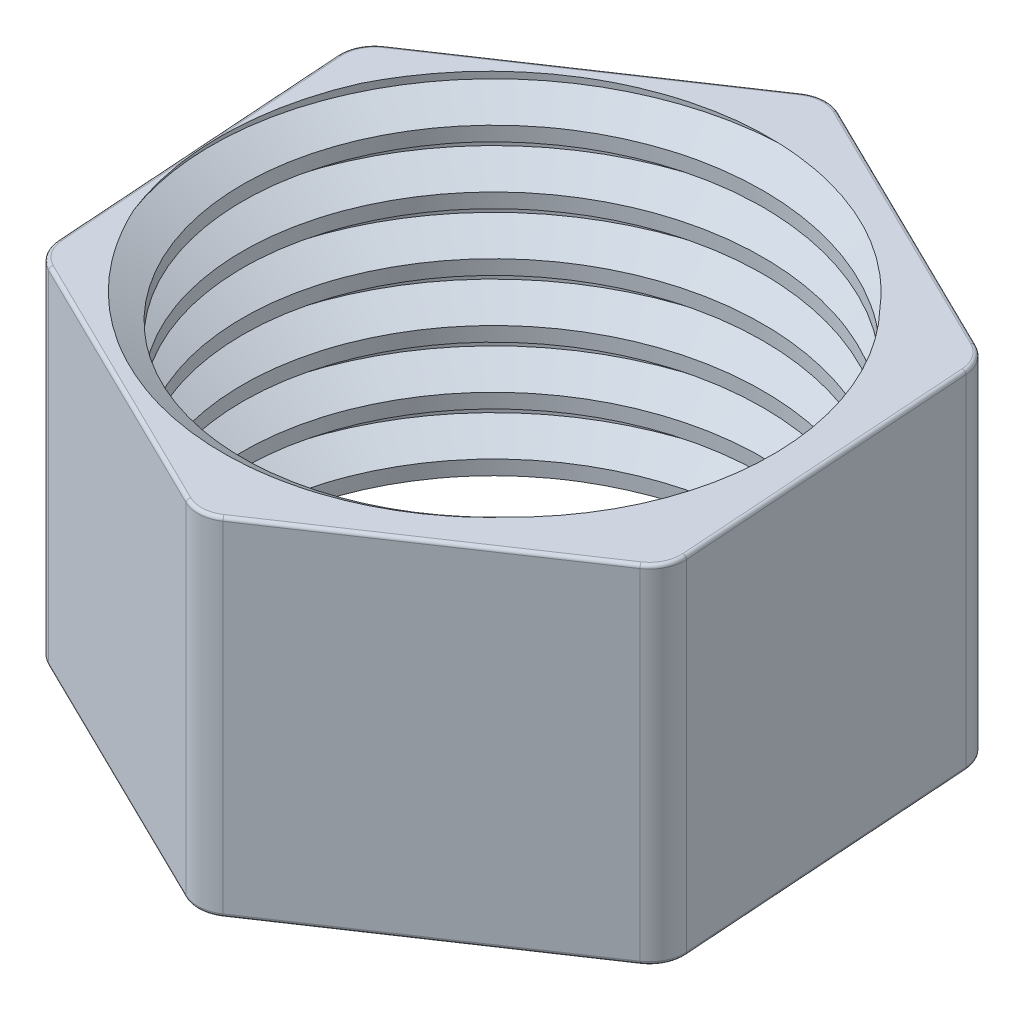
from build123d import *

# Parameters (mm, degrees)
SKETCH1_R           = 9.525
BOSS_EXTRUDE1_DEPTH = 6.35
THREAD1_PITCH       = 2.116666667
FILLET1_R           = 1.27
FILLET2_R           = 0.127


with BuildPart() as part:
    # Sketch1 → Boss-Extrude1 (new, symmetric)
    with BuildSketch(Plane(origin=(0, 0, 0), x_dir=(1, 0, 0), z_dir=(0, 1, 0))):
        Polygon((10.348040622, 6.949394838), (-0.844332159, 12.436363477), (-11.192372782, 5.486968639), (-10.348040622, -6.949394838), (0.844332159, -12.436363477), (11.192372782, -5.486968639), align=None)
        with Locations(Location((0, 0, 0), (0, 0, 270))):
            Circle(SKETCH1_R, mode=Mode.SUBTRACT)
    extrude(amount=BOSS_EXTRUDE1_DEPTH, both=True)

    # Thread1: the profile of Thread Profile1 profile screwed along a right-hand helix of 8.872441 turns, 10 arcs to a turn; built about Z, then put on its axis
    thread1_z = Axis((0, 0, 0), (0, 0, 1))
    thread1_corners = [(9.5247, 0, -0.000173205), (10.670679435, 0, 0.66145833), (10.670679435, 0, 0.926041664), (9.5247, 0, 1.587673199)]
    with BuildLine(mode=Mode.PRIVATE) as thread1_profile:
        Line(thread1_corners[0], thread1_corners[1])
        Line(thread1_corners[1], thread1_corners[2])
        Line(thread1_corners[2], thread1_corners[3])
        Line(thread1_corners[3], thread1_corners[0])
    thread1_cap = Face(thread1_profile.wire())
    thread1_turn_angles = [0, 18, 36, 54, 72, 90, 108, 126, 144, 162, 180, 198, 216, 234, 252, 270, 288, 306, 324, 342, 360]
    thread1_turn_weights = [1, 0.9510565162951535, 1, 0.9510565162951535, 1, 0.9510565162951535, 1, 0.9510565162951535, 1, 0.9510565162951535, 1, 0.9510565162951535, 1, 0.9510565162951535, 1, 0.9510565162951535, 1, 0.9510565162951535, 1, 0.9510565162951535, 1]
    thread1_turn_rails = [Edge.make_bspline([Vector(p[0], p[1], 0).rotate(thread1_z, thread1_turn_angles[k]) / thread1_turn_weights[k] + Vector(0, 0, p[2] + THREAD1_PITCH * thread1_turn_angles[k] / 360) for k in range(21)], [0, 0, 0, 1, 1, 2, 2, 3, 3, 4, 4, 5, 5, 6, 6, 7, 7, 8, 8, 9, 9, 10, 10, 10], 2, thread1_turn_weights) for p in thread1_corners]
    thread1_turn_sides = [Face.make_surface_from_curves(thread1_turn_rails[p[0]], thread1_turn_rails[p[1]]) for p in [(0, 1), (1, 2), (2, 3), (3, 0)]]
    thread1_last_angles = [2880, 2898, 2916, 2934, 2952, 2970, 2988, 3006, 3024, 3042, 3060, 3078, 3096, 3114, 3132, 3150, 3168, 3181.039370079, 3194.078740157]
    thread1_last_weights = [1, 0.9510565162951535, 1, 0.9510565162951535, 1, 0.9510565162951535, 1, 0.9510565162951535, 1, 0.9510565162951535, 1, 0.9510565162951535, 1, 0.9510565162951535, 1, 0.9510565162951535, 1, 0.9742152624638426, 1]
    thread1_last_rails = [Edge.make_bspline([Vector(p[0], p[1], 0).rotate(thread1_z, thread1_last_angles[k]) / thread1_last_weights[k] + Vector(0, 0, p[2] + THREAD1_PITCH * thread1_last_angles[k] / 360) for k in range(19)], [0, 0, 0, 1, 1, 2, 2, 3, 3, 4, 4, 5, 5, 6, 6, 7, 7, 8, 8, 9, 9, 9], 2, thread1_last_weights) for p in thread1_corners]
    thread1_last_sides = [Face.make_surface_from_curves(thread1_last_rails[p[0]], thread1_last_rails[p[1]]) for p in [(0, 1), (1, 2), (2, 3), (3, 0)]]
    thread1 = Plane(origin=(0, -12.43, 0), x_dir=(1, 0, 0), z_dir=(0, 1, 0)) * Solid(Shell([*[p.moved(Location((0, 0, THREAD1_PITCH * i))) for i in range(8) for p in thread1_turn_sides], *thread1_last_sides, thread1_cap, thread1_cap.rotate(thread1_z, 3194.078740157).moved(Location((0, 0, THREAD1_PITCH * 3194.078740157 / 360)))]))
    add(thread1, mode=Mode.SUBTRACT)

    # Fillet1
    fillet1_edges = [part.edges().sort_by_distance(p)[0] for p in [
        (11.192372782, 0, 5.486968639),
        (0.844332159, 0, 12.436363477),
        (-10.348040622, 0, 6.949394838),
        (-11.192372782, 0, -5.486968639),
        (-0.844332159, 0, -12.436363477),
        (10.348040622, 0, -6.949394838),
    ]]
    fillet(fillet1_edges, radius=FILLET1_R)

    # Fillet2
    fillet2_edges = [part.edges().sort_by_distance(p)[0] for p in [
        (-6.018352471, -6.35, -8.961666058),
        (-6.018352471, 6.35, -8.961666058),
        (10.770206702, -6.35, -0.731213099),
        (6.018352471, -6.35, 8.961666058),
        (-4.751854231, -6.35, 9.692879158),
        (-10.770206702, -6.35, 0.731213099),
        (4.751854231, -6.35, -9.692879158),
        (10.184937732, -6.35, -6.839860442),
        (11.015961767, -6.35, 5.400484591),
        (0.831024035, -6.35, 12.240345033),
        (-10.184937732, -6.35, 6.839860442),
        (-11.015961767, -6.35, -5.400484591),
        (-0.831024035, -6.35, -12.240345033),
        (4.751854231, 6.35, -9.692879158),
        (10.770206702, 6.35, -0.731213099),
        (-10.770206702, 6.35, 0.731213099),
        (-4.751854231, 6.35, 9.692879158),
        (6.018352471, 6.35, 8.961666058),
        (10.184937732, 6.35, -6.839860442),
        (11.015961767, 6.35, 5.400484591),
        (0.831024035, 6.35, 12.240345033),
        (-10.184937732, 6.35, 6.839860442),
        (-11.015961767, 6.35, -5.400484591),
        (-0.831024035, 6.35, -12.240345033),
    ]]
    fillet(fillet2_edges, radius=FILLET2_R)


solid = part.part
